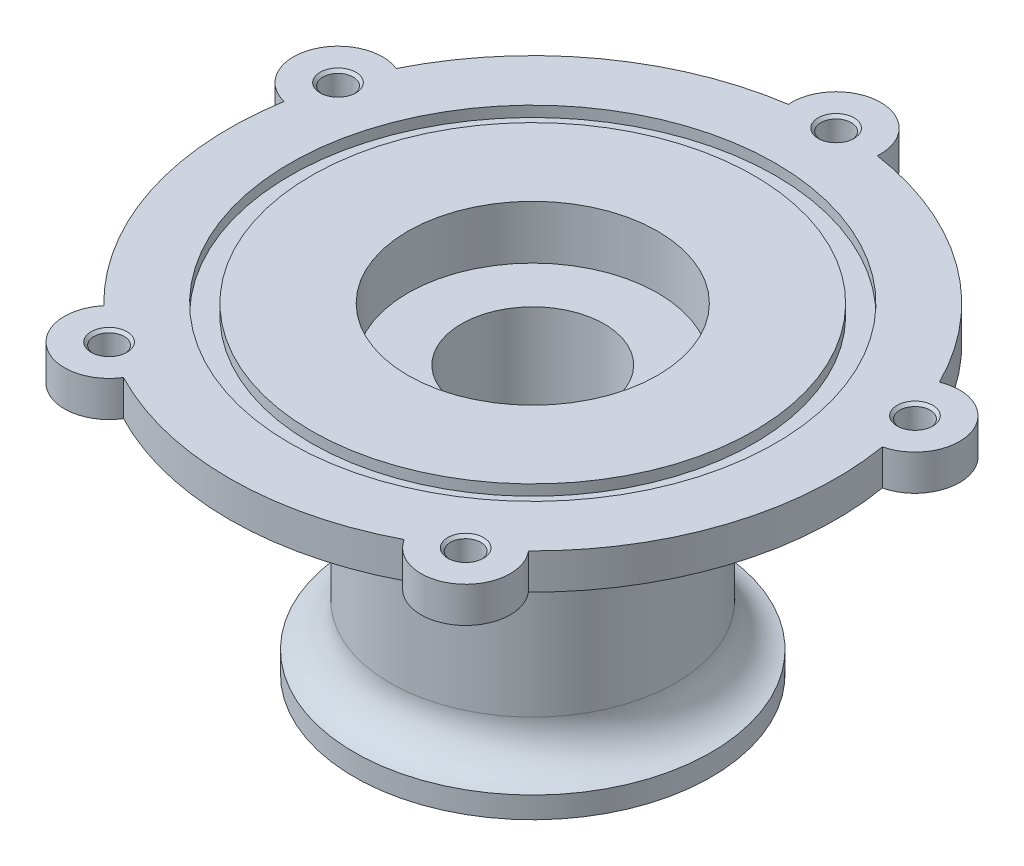
from build123d import *

# Parameters (mm, degrees)
HOLE1_D                      = 40
HOLE1_CBORE_D                = 70
HOLE1_CBORE_DEPTH            = 15
SKETCH4_R                    = 68
SKETCH4_R_2                  = 62
CUT_EXTRUDE1_DEPTH           = 3
FILLET1_R                    = 21
FILLET2_R                    = 12
BOSS_EXTRUDE1_START          = -10
BOSS_EXTRUDE1_DEPTH          = 10
CIRPATTERN1_COUNT            = 5
M10_TAPPED_HOLE1_D           = 8.5
M10_TAPPED_HOLE1_DEPTH       = 21.946342369
M10_TAPPED_HOLE1_CSINK_D     = 10.05
M10_TAPPED_HOLE1_CSINK_ANGLE = 90
M10_TAPPED_HOLE1_TIP         = 2.553657631


with BuildPart() as part:
    # Sketch1 → Revolve1 (revolve)
    with BuildSketch(Plane.XY, mode=Mode.PRIVATE) as revolve1_sk:
        Polygon((0, 0), (0, 90), (-85, 90), (-85, 80), (-40, 80), (-40, 6), (-50, 6), (-50, 0), align=None)
    revolve(revolve1_sk.sketch.rotate(Axis((0, 0, 0), (0, 1, 0)), 270), axis=Axis((0, 0, 0), (0, 1, 0)))

    # Hole1 (through all)
    with Locations(Plane(origin=(0, 90, 0), x_dir=(1, 0, 0), z_dir=(0, 1, 0))):
        with Locations((0, 0)):
            CounterBoreHole(HOLE1_D / 2, HOLE1_CBORE_D / 2, HOLE1_CBORE_DEPTH)

    # Sketch4 → Cut-Extrude1 (cut)
    with BuildSketch(Plane(origin=(0, 90, 0), x_dir=(1, 0, 0), z_dir=(0, 1, 0))):
        with Locations(Location((0, 0, 0), (0, 0, 270))):
            Circle(SKETCH4_R)
        with Locations(Location((0, 0, 0), (0, 0, 270))):
            Circle(SKETCH4_R_2, mode=Mode.SUBTRACT)
    extrude(amount=-CUT_EXTRUDE1_DEPTH, mode=Mode.SUBTRACT)

    # Fillet1
    fillet1_edges = [part.edges().sort_by_distance(p)[0] for p in [
        (0, 80, 40),
    ]]
    fillet(fillet1_edges, radius=FILLET1_R)

    # Fillet2
    # the kernel refuses this fillet: 12 mm, written as the material it adds along each edge
    with BuildSketch(Plane(origin=(0, 6, 0), x_dir=(0, 0, -1), z_dir=(1, 0, 0))) as fillet2_piece_1:
        with BuildLine():
            CenterArc((52, 11.832159566), FILLET2_R, 180, 80.405931773)
            Line((50, 0), (49.96, -0.236643191))
            ThreePointArc((49.96, -0.236643191), (45, -0.24), (40, -0.24))
            Line((40, -0.24), (39.76, 0))
            Line((39.76, 0), (39.76, 11.832159566))
            Line((39.76, 11.832159566), (40, 11.832159566))
        make_face()
    revolve(axis=Axis((0, 6, 0), (0, 1, 0)))

    # Sketch5 → Boss-Extrude1 (add)
    with BuildSketch(Plane(origin=(0, 90, 0), x_dir=(1, 0, 0), z_dir=(0, 1, 0)).offset(BOSS_EXTRUDE1_START)):
        with BuildLine():
            ThreePointArc((12.466163113, 84.080882353), (0, 97.5), (-12.466163113, 84.080882353))
            ThreePointArc((-12.466163113, 84.080882353), (0, 85), (12.466163113, 84.080882353))
        make_face()
    boss_extrude1 = extrude(amount=BOSS_EXTRUDE1_DEPTH)

    # CirPattern1: Boss-Extrude1 ×5 about axis
    cirpattern1_axis = Axis((0, 0, 0), (0, 1, 0))
    for i in range(1, CIRPATTERN1_COUNT):
        add(boss_extrude1.rotate(cirpattern1_axis, i * 360 / CIRPATTERN1_COUNT))

    # M10 Tapped Hole1
    with Locations(Plane(origin=(0, 90, 0), x_dir=(1, 0, 0), z_dir=(0, 1, 0))):
        with Locations((49.961746445, -68.766444522), (-49.961746445, -68.766444522), (80.839803885, 26.266444522), (0, 85), (-80.839803885, 26.266444522)):
            CounterSinkHole(M10_TAPPED_HOLE1_D / 2, M10_TAPPED_HOLE1_CSINK_D / 2, depth=M10_TAPPED_HOLE1_DEPTH, counter_sink_angle=M10_TAPPED_HOLE1_CSINK_ANGLE)
            with Locations((0, 0, -(M10_TAPPED_HOLE1_DEPTH + M10_TAPPED_HOLE1_TIP / 2))):  # 118° drill point
                Cone(0, M10_TAPPED_HOLE1_D / 2, M10_TAPPED_HOLE1_TIP, mode=Mode.SUBTRACT)


solid = part.part
